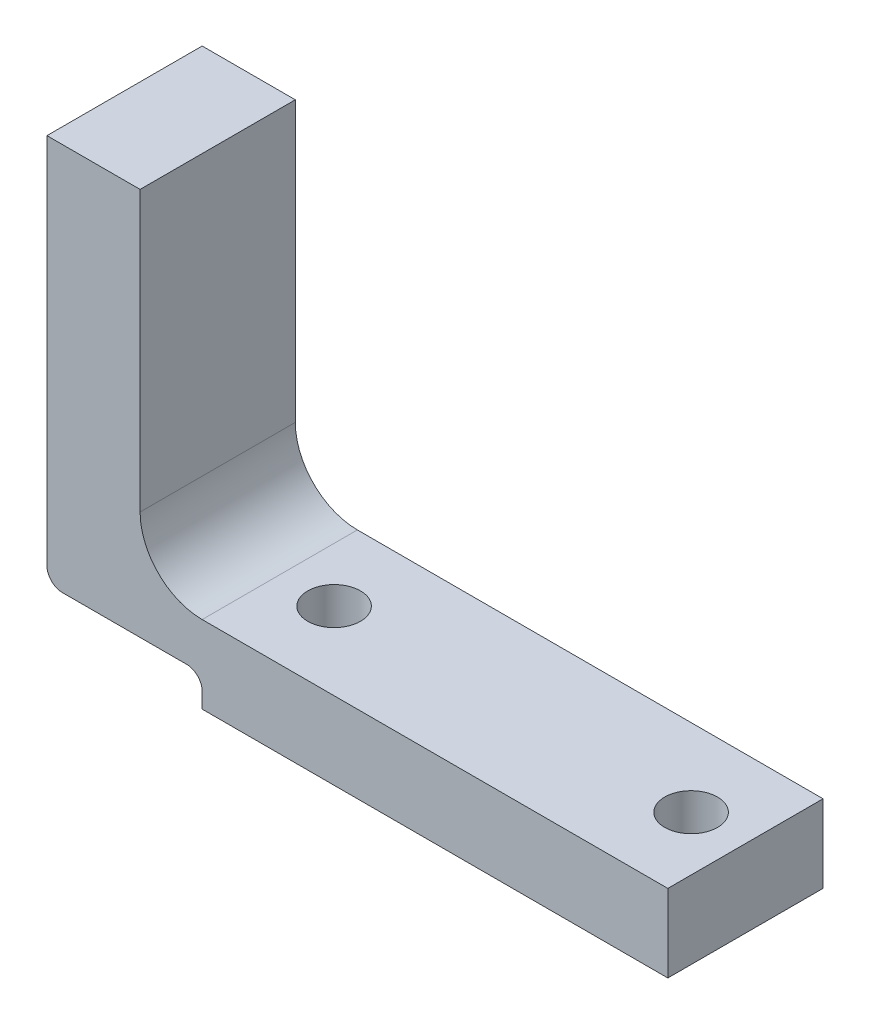
from build123d import *

# Parameters (mm, degrees)
EXTRUDE_1_DEPTH          = 5
FILLET_1_R               = 4
HOLE_WIZARD_M3_1_D       = 3.4
HOLE_WIZARD_M3_1_2_D     = 2.5
HOLE_WIZARD_M3_1_2_DEPTH = 5
HOLE_WIZARD_M3_1_2_TIP   = 0.751075774
SKETCH_7_W               = 10
SKETCH_7_H               = 2
CUT_EXTRUDE_1_DEPTH      = 50.284886121
FILLET_2_R               = 1


with BuildPart() as part:
    # 草图1 → 凸台-拉伸1 (new, symmetric)
    with BuildSketch(Plane.XY):
        Polygon((0, 27), (0, 0), (40, 0), (40, 5), (6, 5), (6, 27), align=None)
    extrude(amount=EXTRUDE_1_DEPTH, both=True)

    # 圆角1
    fillet_1_edges = [part.edges().sort_by_distance(p)[0] for p in [
        (6, 5, 0),
    ]]
    fillet(fillet_1_edges, radius=FILLET_1_R)

    # Hole Wizard M3 _1 (through all)
    with Locations(Plane(origin=(13.5, 5, 0), x_dir=(1, 0, 0), z_dir=(0, 1, 0))):
        with Locations((0, 0), (23, 0)):
            Hole(HOLE_WIZARD_M3_1_D / 2)

    # Hole Wizard M3 _1 2
    with Locations(Plane(origin=(0, 6, 0), x_dir=(0, 0, -1), z_dir=(-1, 0, 0))):
        with Locations((0, 0), (0, -17)):
            Hole(HOLE_WIZARD_M3_1_2_D / 2, depth=HOLE_WIZARD_M3_1_2_DEPTH)
            with Locations((0, 0, -(HOLE_WIZARD_M3_1_2_DEPTH + HOLE_WIZARD_M3_1_2_TIP / 2))):  # 118° drill point
                Cone(0, HOLE_WIZARD_M3_1_2_D / 2, HOLE_WIZARD_M3_1_2_TIP, mode=Mode.SUBTRACT)

    # 草图7 → 切除-拉伸1 (cut, through all)
    with BuildSketch(Plane.XY.offset(5)):
        with Locations((5, 1)):
            Rectangle(SKETCH_7_W, SKETCH_7_H)
    extrude(amount=-CUT_EXTRUDE_1_DEPTH, mode=Mode.SUBTRACT)

    # 圆角2
    fillet_2_edges = [part.edges().sort_by_distance(p)[0] for p in [
        (0, 2, 0),
        (10, 2, 0),
    ]]
    fillet(fillet_2_edges, radius=FILLET_2_R)


solid = part.part
